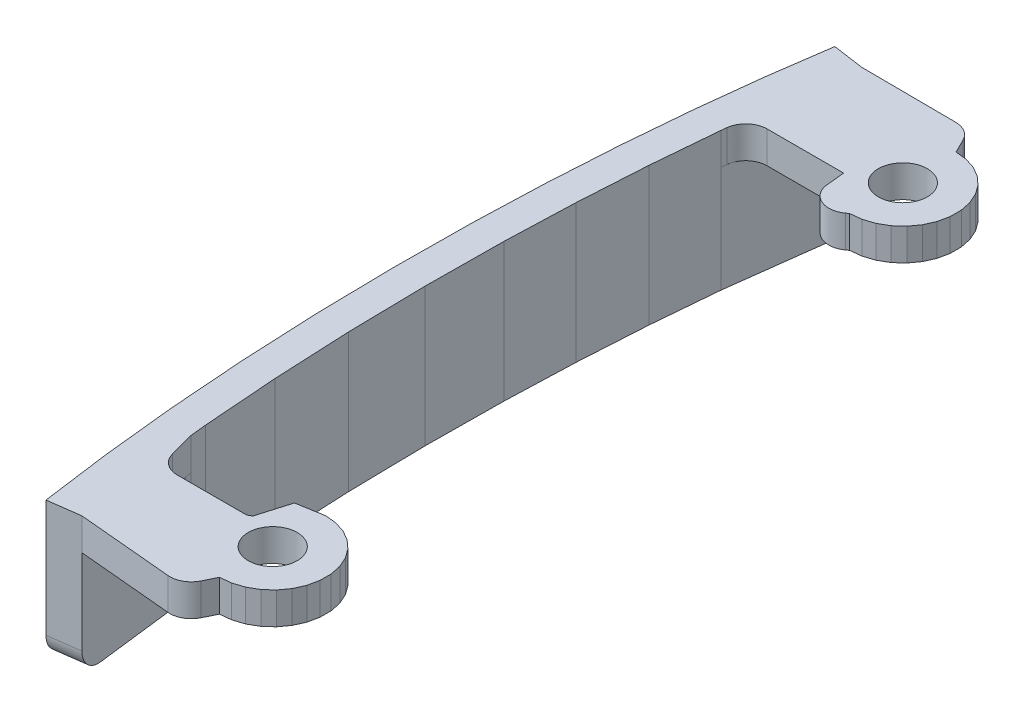
from build123d import *

# Parameters (mm, degrees)
SZKIC2_R                    = 1.15000024
DODANIE_WYCI_GNI_CIE1_DEPTH = 1.5
DODANIE_WYCI_GNI_CIE2_DEPTH = 5
ZAOKR_GLENIE1_R             = 1


with BuildPart() as part:
    # Szkic2 → Dodanie-wyciągnięcie1 (new body)
    with BuildSketch(Plane(origin=(0, 0.9903587, 0), x_dir=(1, 0, 0), z_dir=(0, 1, 0))):
        with BuildLine():
            Line((-173.537057861, -25.629454659), (-177.980234802, -25.600470859))
            Line((-177.980234802, -25.600470859), (-179.465273063, -25.389138502))
            Line((-179.465273063, -25.389138502), (-179.875270484, -28.27020162))
            Line((-179.875270484, -28.27020162), (-180.220882829, -31.315847433))
            Line((-180.220882829, -31.315847433), (-180.496294073, -34.480041019))
            Line((-180.496294073, -34.480041019), (-180.693629515, -37.735565991))
            Line((-180.693629515, -37.735565991), (-180.810996631, -41.053218548))
            Line((-180.810996631, -41.053218548), (-180.844357588, -44.770440674))
            Line((-180.844357588, -44.770440674), (-180.776598606, -48.479996177))
            Line((-180.776598606, -48.479996177), (-180.606637328, -52.137204019))
            Line((-180.606637328, -52.137204019), (-180.340406733, -55.699429047))
            Line((-180.340406733, -55.699429047), (-179.981756968, -59.127877551))
            Line((-179.981756968, -59.127877551), (-179.544751696, -62.365140152))
            Line((-179.544751696, -62.365140152), (-178.058234871, -62.164471942))
            Line((-178.058234871, -62.164471942), (-173.603659928, -62.571167494))
            ThreePointArc((-173.603659928, -62.571167494), (-173.024806006, -62.44819003), (-172.616824171, -62.019533826))
            Line((-172.616824171, -62.019533826), (-172.326234878, -61.433471042))
            Line((-172.326234878, -61.433471042), (-171.806234897, -61.378472644))
            Line((-171.806234897, -61.378472644), (-171.309234799, -61.217471439))
            Line((-171.309234799, -61.217471439), (-170.856234968, -60.956471759))
            Line((-170.856234968, -60.956471759), (-170.468234957, -60.606471377))
            Line((-170.468234957, -60.606471377), (-170.161234797, -60.183471042))
            Line((-170.161234797, -60.183471042), (-169.948234976, -59.706471759))
            Line((-169.948234976, -59.706471759), (-169.840234936, -59.194472629))
            Line((-169.840234936, -59.194472629), (-169.840234936, -58.672471362))
            Line((-169.840234936, -58.672471362), (-169.948234976, -58.160472232))
            Line((-169.948234976, -58.160472232), (-170.161234797, -57.683471042))
            Line((-170.161234797, -57.683471042), (-170.468234957, -57.260472613))
            Line((-170.468234957, -57.260472613), (-170.856234968, -56.910472232))
            Line((-170.856234968, -56.910472232), (-171.309234799, -56.649472552))
            Line((-171.309234799, -56.649472552), (-171.806234897, -56.488471347))
            Line((-171.806234897, -56.488471347), (-172.326234878, -56.433471042))
            Line((-172.326234878, -56.433471042), (-173.590153384, -56.649472552))
            Line((-173.590153384, -56.649472552), (-174.035645958, -58.160472232))
            Line((-174.035645958, -58.160472232), (-174.223992711, -58.263046011))
            Line((-174.223992711, -58.263046011), (-177.48282769, -58.263046011))
            ThreePointArc((-177.48282769, -58.263046011), (-178.091581224, -58.056405409), (-178.448748365, -57.52188428))
            Line((-178.448748365, -57.52188428), (-178.765053408, -56.341511761))
            Line((-178.765053408, -56.341511761), (-178.846234978, -55.565471011))
            Line((-178.846234978, -55.565471011), (-179.109234989, -52.046471912))
            Line((-179.109234989, -52.046471912), (-179.277234734, -48.43147214))
            Line((-179.277234734, -48.43147214), (-179.344234646, -44.763472873))
            Line((-179.344234646, -44.763472873), (-179.311234654, -41.08647092))
            Line((-179.311234654, -41.08647092), (-179.195234955, -37.807471591))
            Line((-179.195234955, -37.807471591), (-179.000234783, -34.590472537))
            Line((-179.000234783, -34.590472537), (-178.728234947, -31.465472537))
            Line((-178.728234947, -31.465472537), (-178.700062197, -31.217205306))
            ThreePointArc((-178.700062197, -31.217205306), (-178.372489594, -30.58405239), (-177.706439248, -30.329959177))
            Line((-177.706439248, -30.329959177), (-174.112522963, -30.329959177))
            Line((-174.112522963, -30.329959177), (-174.022657546, -31.208577866))
            ThreePointArc((-174.022657546, -31.208577866), (-173.436715177, -32.019422034), (-172.441579371, -31.91694544))
            Line((-172.441579371, -31.91694544), (-172.326234878, -31.833472568))
            Line((-172.326234878, -31.833472568), (-171.806234897, -31.778472262))
            Line((-171.806234897, -31.778472262), (-171.309234799, -31.617472964))
            Line((-171.309234799, -31.617472964), (-170.856234968, -31.356471377))
            Line((-170.856234968, -31.356471377), (-170.468234957, -31.006472903))
            Line((-170.468234957, -31.006472903), (-170.161234797, -30.583472568))
            Line((-170.161234797, -30.583472568), (-169.948234976, -30.106471377))
            Line((-169.948234976, -30.106471377), (-169.840234936, -29.59447034))
            Line((-169.840234936, -29.59447034), (-169.840234936, -29.072470981))
            Line((-169.840234936, -29.072470981), (-169.948234976, -28.560469943))
            Line((-169.948234976, -28.560469943), (-170.161234797, -28.083472568))
            Line((-170.161234797, -28.083472568), (-170.468234957, -27.660472232))
            Line((-170.468234957, -27.660472232), (-170.856234968, -27.310469943))
            Line((-170.856234968, -27.310469943), (-171.309234799, -27.049472171))
            Line((-171.309234799, -27.049472171), (-171.806234897, -26.888472873))
            Line((-171.806234897, -26.888472873), (-172.326234878, -26.833472568))
            Line((-172.326234878, -26.833472568), (-172.647665436, -26.185208875))
            ThreePointArc((-172.647665436, -26.185208875), (-173.013661572, -25.781385351), (-173.537057861, -25.629454659))
        make_face()
        with Locations((-172.326039002, -29.333481885)):
            Circle(SZKIC2_R, mode=Mode.SUBTRACT)
        with Locations((-172.326039002, -58.933463325)):
            Circle(SZKIC2_R, mode=Mode.SUBTRACT)
    extrude(amount=DODANIE_WYCI_GNI_CIE1_DEPTH)

    # Szkic3 → Dodanie-wyciągnięcie2 (add)
    with BuildSketch(Plane.XZ.offset(-0.9903587)):
        Polygon((-178.765053408, 56.341511761), (-178.058234871, 62.164471942), (-179.544751696, 62.365140152), (-179.981756968, 59.127877551), (-180.340406733, 55.699429047), (-180.606637328, 52.137204019), (-180.776598606, 48.479996177), (-180.844357588, 44.770440674), (-180.810996631, 41.053218548), (-180.693629515, 37.735565991), (-180.496294073, 34.480041019), (-180.220882829, 31.315847433), (-179.875270484, 28.27020162), (-179.465273063, 25.389138502), (-177.980234802, 25.600470859), (-178.728234947, 31.465472537), (-179.000234783, 34.590472537), (-179.195234955, 37.807471591), (-179.311234654, 41.08647092), (-179.344234646, 44.763472873), (-179.277234734, 48.43147214), (-179.109234989, 52.046471912), (-178.846234978, 55.565471011), align=None)
    extrude(amount=DODANIE_WYCI_GNI_CIE2_DEPTH)

    # Zaokrąglenie1
    zaokr_glenie1_edges = [part.edges().sort_by_distance(p)[0] for p in [
        (-178.801493283, -4.0096413, 62.264806047),
        (-178.722753933, -4.0096413, 25.49480468),
    ]]
    fillet(zaokr_glenie1_edges, radius=ZAOKR_GLENIE1_R)


solid = part.part
